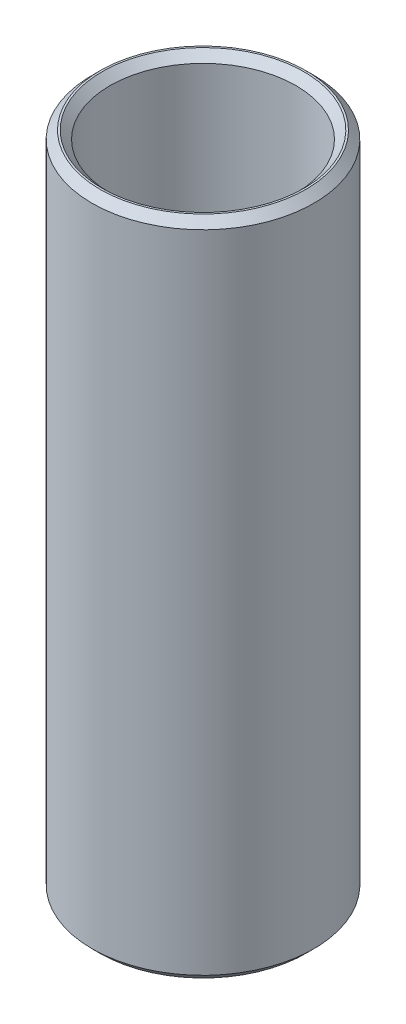
from build123d import *

# Parameters (mm, degrees)
SKETCH1_R           = 35
BOSS_EXTRUDE1_DEPTH = 208.796272096
SKETCH2_R           = 29.345992627
CUT_EXTRUDE1_DEPTH  = 215.583045093
CHAMFER1_SIZE       = 2.527362389


with BuildPart() as part:
    # Sketch1 → Boss-Extrude1 (new body)
    with BuildSketch(Plane(origin=(0, 0, 0), x_dir=(1, 0, 0), z_dir=(0, 1, 0))):
        Circle(SKETCH1_R)
    extrude(amount=BOSS_EXTRUDE1_DEPTH)

    # Sketch2 → Cut-Extrude1 (cut, through all)
    with BuildSketch(Plane(origin=(0, 0, 0), x_dir=(1, 0, 0), z_dir=(0, 1, 0))):
        Circle(SKETCH2_R)
    extrude(amount=CUT_EXTRUDE1_DEPTH, mode=Mode.SUBTRACT)

    # Chamfer1
    chamfer1_edges = [part.edges().sort_by_distance(p)[0] for p in [
        (-29.345992627, 208.796272096, 0),
        (-29.345992627, 0, 0),
        (-35, 0, 0),
        (-35, 208.796272096, 0),
    ]]
    chamfer(chamfer1_edges, length=CHAMFER1_SIZE)


solid = part.part
